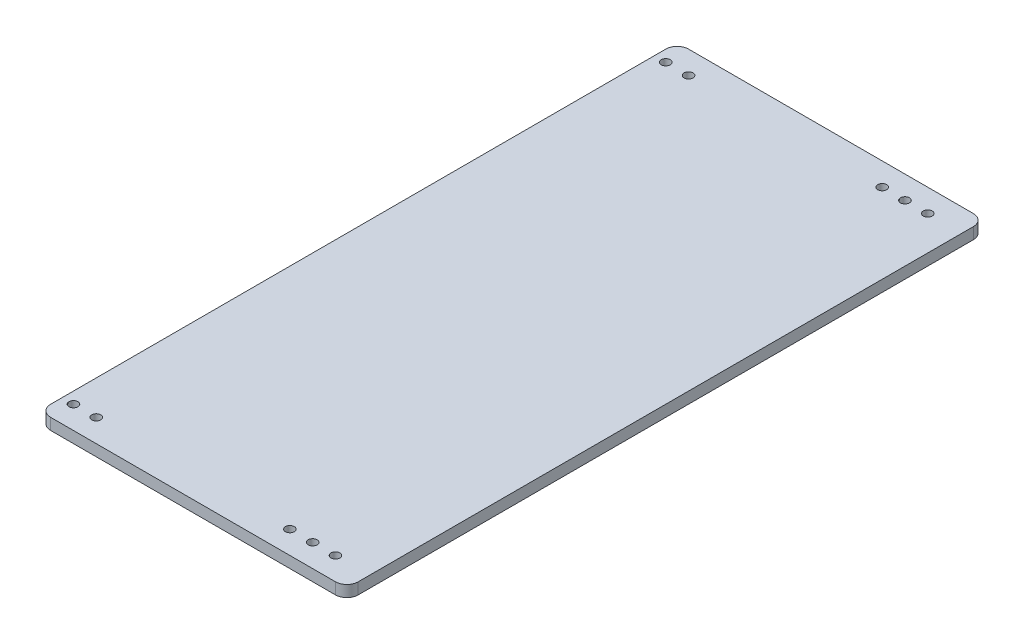
from build123d import *

# Parameters (mm, degrees)
SKETCH1_W           = 171.45
SKETCH1_H           = 355.6
BOSS_EXTRUDE1_DEPTH = 6.35
SKETCH2_R           = 2.4892
CUT_EXTRUDE2_DEPTH  = 198.489083559
FILLET1_R           = 6.35


with BuildPart() as part:
    # Sketch1 → Boss-Extrude1 (new body)
    with BuildSketch(Plane(origin=(0, 0, 0), x_dir=(1, 0, 0), z_dir=(0, 1, 0))):
        Rectangle(SKETCH1_W, SKETCH1_H)
    extrude(amount=BOSS_EXTRUDE1_DEPTH)

    # Sketch2 → Cut-Extrude2 (cut, through all)
    with BuildSketch(Plane(origin=(0, 6.35, 0), x_dir=(1, 0, 0), z_dir=(0, 1, 0))):
        with Locations((66.675, -165.1)):
            Circle(SKETCH2_R)
        with Locations((53.975, -165.1)):
            Circle(SKETCH2_R)
        with Locations((41.275, -165.1)):
            Circle(SKETCH2_R)
        with Locations((66.675, 165.1)):
            Circle(SKETCH2_R)
        with Locations((53.975, 165.1)):
            Circle(SKETCH2_R)
        with Locations((41.275, 165.1)):
            Circle(SKETCH2_R)
        with Locations((-79.375, -165.1)):
            Circle(SKETCH2_R)
        with Locations((-66.675, -165.1)):
            Circle(SKETCH2_R)
        with Locations((-79.375, 165.1)):
            Circle(SKETCH2_R)
        with Locations((-66.675, 165.1)):
            Circle(SKETCH2_R)
    extrude(amount=-CUT_EXTRUDE2_DEPTH, mode=Mode.SUBTRACT)

    # Fillet1
    fillet1_edges = [part.edges().sort_by_distance(p)[0] for p in [
        (85.725, 3.175, 177.8),
        (-85.725, 3.175, 177.8),
        (-85.725, 3.175, -177.8),
        (85.725, 3.175, -177.8),
    ]]
    fillet(fillet1_edges, radius=FILLET1_R)


solid = part.part
